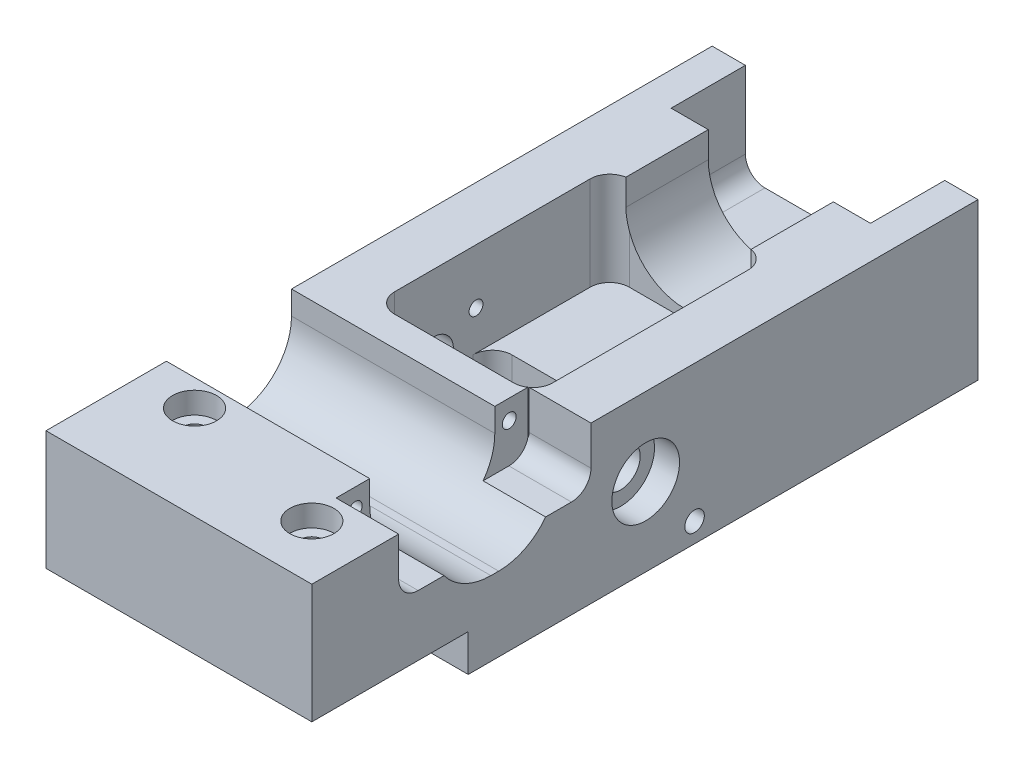
from build123d import *

# Parameters (mm, degrees)
BASE_DEPTH                    = 12.7
BASE_DEPTH_BACK               = 12.7
SKETCH1_W                     = 43.18
SKETCH1_H                     = 108.204
ACTUATORPLANECUT_DEPTH        = 6.0325
CENTERSLOT_DEPTH              = 60.619162222
CENTERSLOT_DEPTH_BACK         = 60.619162222
SKETCH5_W                     = 25.654
SKETCH5_H                     = 19.05
SHAFTGUIDE_REACH              = 113.065
SKETCH2_R                     = 4.7625
CENTERSLOTFILLET_R            = 3.175
GEARBOXPIT_DEPTH              = 11.176
FRONTCUTAWAY_DEPTH            = 15.24
GEARBOXSLOTSH_DEPTH           = 2.286
SKETCH55_R                    = 1.5875
GUIDEBARHOLE_DEPTH            = 71.376336961
PITCHSHAFTHOLE_DEPTH          = 60.619162279
PITCHSHAFTHOLE_DEPTH_BACK     = 60.619162279
SKETCH56_R                    = 3.175
SKETCH57_R                    = 5.5
BEARINGBORER_DEPTH            = 4.064
TOGGLEASSEMHOLES_D            = 2.7051
TOGGLEASSEMHOLES_DEPTH        = 9.398
TOGGLEASSEMHOLES_TIP          = 0.81269403
PITCHMOTORSLOT_DEPTH          = 71.37633704
PITCHMOTORMOUNTINGSLOTS_DEPTH = 10.16
PITCHMOTORMOUNTINGHOLES_D     = 2.2606
PITCHMOTORMOUNTINGHOLES_DEPTH = 7.5946
PITCHMOTORMOUNTINGHOLES_TIP   = 0.679152758
GEARBOXMOUNTINGHOLES_D        = 2.7051
GEARBOXMOUNTINGHOLES_DEPTH    = 9.398
GEARBOXMOUNTINGHOLES_TIP      = 0.81269403
CAPMOUNTINGHOLES_D            = 3.6576
CAPMOUNTINGHOLES_CBORE_D      = 7.14502
CAPMOUNTINGHOLES_CBORE_DEPTH  = 3.5052
ENCODERMOUNTINGHOLES_D        = 2.2606
ENCODERMOUNTINGHOLES_DEPTH    = 10.1346
ENCODERMOUNTINGHOLES_TIP      = 0.679152758
ROLLMOTORSLOT_REACH           = 113.065
ROLLMOTORMOUNTINGSLOTS_DEPTH  = 12.065
ROLLMOTORMOUNTINGHOLES_D      = 2.2606
ROLLMOTORMOUNTINGHOLES_DEPTH  = 7.62
ROLLMOTORMOUNTINGHOLES_TIP    = 0.679152758


with BuildPart() as part:
    # Sketch1 → Base (new, two sides: drawn at the far end of the back side and taken through both)
    with BuildSketch(Plane(origin=(0, 0, 0), x_dir=(1, 0, 0), z_dir=(0, 1, 0)).offset(-BASE_DEPTH_BACK)):
        Rectangle(SKETCH1_W, SKETCH1_H)
    extrude(amount=BASE_DEPTH + BASE_DEPTH_BACK)

    # Sketch3 → ActuatorPlaneCut (cut)
    with BuildSketch(Plane(origin=(0, -12.7, 0), x_dir=(-1, 0, 0), z_dir=(0, -1, 0))):
        Polygon((10.922, -28.702), (16.256, -28.702), (21.59, -28.702), (21.59, -54.102), (-21.59, -54.102), (-21.59, -28.702), (-10.922, -28.702), (-10.922, -11.176), (10.922, -11.176), align=None)
    extrude(amount=-ACTUATORPLANECUT_DEPTH, mode=Mode.SUBTRACT)

    # Sketch5 → CenterSlot (cut, two sides: drawn at the far end of the back side and taken through both)
    with BuildSketch(Plane(origin=(0, 0, 0), x_dir=(1, 0, 0), z_dir=(0, 1, 0)).offset(-CENTERSLOT_DEPTH_BACK)):
        with Locations((0, 0.127)):
            Rectangle(SKETCH5_W, SKETCH5_H)
    extrude(amount=CENTERSLOT_DEPTH + CENTERSLOT_DEPTH_BACK, mode=Mode.SUBTRACT)

    # Sketch2 → ShaftGuide (cut, up to next)
    with BuildSketch(Plane(origin=(0, 0, -54.102), x_dir=(-1, 0, 0), z_dir=(0, 0, -1)), mode=Mode.PRIVATE) as shaftguide_sk1:
        with Locations((0, -12.7)):
            Circle(SKETCH2_R)
    shaftguide_tool1 = extrude(shaftguide_sk1.sketch, amount=-SHAFTGUIDE_REACH, mode=Mode.PRIVATE) & part.part
    add(shaftguide_tool1.solids().sort_by_distance((0, -12.7, -54.102))[0], mode=Mode.SUBTRACT)

    # CenterSlotFillet
    centerslotfillet_edges = [part.edges().sort_by_distance(p)[0] for p in [
        (-12.827, 0, -9.652),
        (-12.827, 0, 9.398),
        (12.827, 0, 9.398),
        (12.827, 0, -9.652),
    ]]
    fillet(centerslotfillet_edges, radius=CENTERSLOTFILLET_R)

    # Sketch40 → GearBoxPit (cut)
    with BuildSketch(Plane.XZ.offset(12.7)):
        with BuildLine():
            Line((10.922, 6.858), (-10.922, 6.858))
            Line((-10.922, 6.858), (-10.922, 25.527))
            ThreePointArc((-10.922, 25.527), (-9.99206403, 27.77206403), (-7.747, 28.702))
            Line((-7.747, 28.702), (7.747, 28.702))
            ThreePointArc((7.747, 28.702), (9.99206403, 27.77206403), (10.922, 25.527))
            Line((10.922, 25.527), (10.922, 6.858))
        make_face()
    extrude(amount=-GEARBOXPIT_DEPTH, mode=Mode.SUBTRACT)

    # Sketch60 → FrontCutaway (cut)
    with BuildSketch(Plane(origin=(0, 12.7, 0), x_dir=(1, 0, 0), z_dir=(0, 1, 0))):
        with BuildLine():
            Line((-12.827, 6.477), (12.827, 6.477))
            Line((12.827, 6.477), (12.827, 25.527))
            ThreePointArc((12.827, 25.527), (11.89706403, 27.77206403), (9.652, 28.702))
            Line((9.652, 28.702), (-9.652, 28.702))
            ThreePointArc((-9.652, 28.702), (-11.89706403, 27.77206403), (-12.827, 25.527))
            Line((-12.827, 25.527), (-12.827, 6.477))
        make_face()
    extrude(amount=-FRONTCUTAWAY_DEPTH, mode=Mode.SUBTRACT)

    # Sketch67 → GearBoxSlotsH (cut)
    with BuildSketch(Plane(origin=(0, -12.7, 0), x_dir=(-1, 0, 0), z_dir=(0, -1, 0))):
        with BuildLine():
            Line((-12.3825, -12.811125), (12.3825, -12.811125))
            ThreePointArc((12.3825, -12.811125), (12.779375, -13.208), (12.3825, -13.604875))
            Line((12.3825, -13.604875), (-12.3825, -13.604875))
            ThreePointArc((-12.3825, -13.604875), (-12.779375, -13.208), (-12.3825, -12.811125))
        make_face()
        with BuildLine():
            Line((-12.3825, -23.479125), (12.3825, -23.479125))
            ThreePointArc((12.3825, -23.479125), (12.779375, -23.876), (12.3825, -24.272875))
            Line((12.3825, -24.272875), (-12.3825, -24.272875))
            ThreePointArc((-12.3825, -24.272875), (-12.779375, -23.876), (-12.3825, -23.479125))
        make_face()
    extrude(amount=-GEARBOXSLOTSH_DEPTH, mode=Mode.SUBTRACT)

    # Sketch55 → GuideBarHole (cut, through all)
    with BuildSketch(Plane.ZY.offset(21.59)):
        with Locations((-8.0645, -9.525)):
            Circle(SKETCH55_R)
    extrude(amount=-GUIDEBARHOLE_DEPTH, mode=Mode.SUBTRACT)

    # Sketch56 → PitchShaftHole (cut, two sides: drawn at the far end of the back side and taken through both)
    with BuildSketch(Plane(origin=(0, 0, 0), x_dir=(0, 0, -1), z_dir=(1, 0, 0)).offset(-PITCHSHAFTHOLE_DEPTH_BACK)):
        with Locations((0.127, 0)):
            Circle(SKETCH56_R)
    extrude(amount=PITCHSHAFTHOLE_DEPTH + PITCHSHAFTHOLE_DEPTH_BACK, mode=Mode.SUBTRACT)

    # Sketch57 → BearingBoreR (cut)
    with BuildSketch(Plane.ZY.offset(21.59)):
        with Locations((-0.127, 0)):
            Circle(SKETCH57_R)
    bearingborer = extrude(amount=-BEARINGBORER_DEPTH, mode=Mode.SUBTRACT)

    # BearingBoreL: BearingBoreR across plane
    add(bearingborer.mirror(Plane(origin=(0, 0, 0), x_dir=(0, 0, 1), z_dir=(1, 0, 0))), mode=Mode.SUBTRACT)

    # ToggleAssemHoles
    with Locations(Plane(origin=(0, -12.7, 0), x_dir=(-1, 0, 0), z_dir=(0, -1, 0))):
        with Locations((15.875, 22.352), (-15.875, 22.352)):
            Hole(TOGGLEASSEMHOLES_D / 2, depth=TOGGLEASSEMHOLES_DEPTH)
            with Locations((0, 0, -(TOGGLEASSEMHOLES_DEPTH + TOGGLEASSEMHOLES_TIP / 2))):  # 118° drill point
                Cone(0, TOGGLEASSEMHOLES_D / 2, TOGGLEASSEMHOLES_TIP, mode=Mode.SUBTRACT)

    # Sketch62 → PitchMotorSlot (cut, through all)
    with BuildSketch(Plane.ZY.offset(21.59)):
        with BuildLine():
            Line((14.224, 9.525), (14.224, 12.7))
            Line((14.224, 12.7), (34.544, 12.7))
            Line((34.544, 12.7), (34.544, 9.525))
            Line((34.544, 9.525), (34.544, 8.89))
            ThreePointArc((34.544, 8.89), (31.754192091, 2.154807909), (25.019, -0.635))
            Line((25.019, -0.635), (23.749, -0.635))
            ThreePointArc((23.749, -0.635), (17.013807909, 2.154807909), (14.224, 8.89))
            Line((14.224, 8.89), (14.224, 9.525))
        make_face()
    extrude(amount=-PITCHMOTORSLOT_DEPTH, mode=Mode.SUBTRACT)

    # Sketch63 → PitchMotorMountingSlots (cut)
    with BuildSketch(Plane.ZY.offset(-21.59)):
        with BuildLine():
            Line((8.763, 12.7), (40.005, 12.7))
            Line((40.005, 12.7), (40.005, 6.35))
            ThreePointArc((40.005, 6.35), (39.07506403, 4.10493597), (36.83, 3.175))
            Line((36.83, 3.175), (11.938, 3.175))
            ThreePointArc((11.938, 3.175), (9.69293597, 4.10493597), (8.763, 6.35))
            Line((8.763, 6.35), (8.763, 12.7))
        make_face()
    extrude(amount=PITCHMOTORMOUNTINGSLOTS_DEPTH, mode=Mode.SUBTRACT)

    # PitchMotorMountingHoles
    with Locations(Plane(origin=(11.43, 0, 0), x_dir=(0, 0, -1), z_dir=(1, 0, 0))):
        with Locations((-36.884, 9.525), (-11.884, 9.525)):
            Hole(PITCHMOTORMOUNTINGHOLES_D / 2, depth=PITCHMOTORMOUNTINGHOLES_DEPTH)
            with Locations((0, 0, -(PITCHMOTORMOUNTINGHOLES_DEPTH + PITCHMOTORMOUNTINGHOLES_TIP / 2))):  # 118° drill point
                Cone(0, PITCHMOTORMOUNTINGHOLES_D / 2, PITCHMOTORMOUNTINGHOLES_TIP, mode=Mode.SUBTRACT)

    # GearBoxMountingHoles
    with Locations(Plane(origin=(0, -12.7, 0), x_dir=(-1, 0, 0), z_dir=(0, -1, 0))):
        with Locations((-16.256, -18.542), (16.256, -18.542)):
            Hole(GEARBOXMOUNTINGHOLES_D / 2, depth=GEARBOXMOUNTINGHOLES_DEPTH)
            with Locations((0, 0, -(GEARBOXMOUNTINGHOLES_DEPTH + GEARBOXMOUNTINGHOLES_TIP / 2))):  # 118° drill point
                Cone(0, GEARBOXMOUNTINGHOLES_D / 2, GEARBOXMOUNTINGHOLES_TIP, mode=Mode.SUBTRACT)

    # CapMountingHoles (through all)
    with Locations(Plane(origin=(-0.837932951, 12.7, 8.633720573), x_dir=(-1, 0, 0), z_dir=(0, 1, 0))):
        with Locations((-13.537932951, 36.578279427), (11.862067049, 30.228279427)):
            CounterBoreHole(CAPMOUNTINGHOLES_D / 2, CAPMOUNTINGHOLES_CBORE_D / 2, CAPMOUNTINGHOLES_CBORE_DEPTH)

    # EncoderMountingHoles
    with Locations(Plane.ZY.offset(21.59)):
        with Locations((6.731, 3.81), (-6.985, 3.81)):
            Hole(ENCODERMOUNTINGHOLES_D / 2, depth=ENCODERMOUNTINGHOLES_DEPTH)
            with Locations((0, 0, -(ENCODERMOUNTINGHOLES_DEPTH + ENCODERMOUNTINGHOLES_TIP / 2))):  # 118° drill point
                Cone(0, ENCODERMOUNTINGHOLES_D / 2, ENCODERMOUNTINGHOLES_TIP, mode=Mode.SUBTRACT)

    # Sketch81 → RollMotorSlot (cut, up to next)
    with BuildSketch(Plane(origin=(0, 0, -54.102), x_dir=(-1, 0, 0), z_dir=(0, 0, -1)), mode=Mode.PRIVATE) as rollmotorslot_sk1:
        with BuildLine():
            Line((10.16, 12.7), (-10.16, 12.7))
            Line((-10.16, 12.7), (-10.16, 8.46582))
            ThreePointArc((-10.16, 8.46582), (-7.370192091, 1.730627909), (-0.635, -1.05918))
            Line((-0.635, -1.05918), (0.635, -1.05918))
            ThreePointArc((0.635, -1.05918), (7.370192091, 1.730627909), (10.16, 8.46582))
            Line((10.16, 8.46582), (10.16, 12.7))
        make_face()
    rollmotorslot_tool1 = extrude(rollmotorslot_sk1.sketch, amount=-ROLLMOTORSLOT_REACH, mode=Mode.PRIVATE) & part.part
    add(rollmotorslot_tool1.solids().sort_by_distance((0, 6.589347, -54.102))[0], mode=Mode.SUBTRACT)

    # Sketch84 → RollMotorMountingSlots (cut)
    with BuildSketch(Plane(origin=(0, 0, -54.102), x_dir=(-1, 0, 0), z_dir=(0, 0, -1))):
        with BuildLine():
            Line((16.1925, 12.7), (-16.1925, 12.7))
            Line((-16.1925, 12.7), (-16.1925, 0.21082))
            ThreePointArc((-16.1925, 0.21082), (-15.26256403, -2.03424403), (-13.0175, -2.96418))
            Line((-13.0175, -2.96418), (13.0175, -2.96418))
            ThreePointArc((13.0175, -2.96418), (15.26256403, -2.03424403), (16.1925, 0.21082))
            Line((16.1925, 0.21082), (16.1925, 12.7))
        make_face()
    extrude(amount=-ROLLMOTORMOUNTINGSLOTS_DEPTH, mode=Mode.SUBTRACT)

    # RollMotorMountingHoles
    with Locations(Plane(origin=(0, 0, -42.037), x_dir=(-1, 0, 0), z_dir=(0, 0, -1))):
        with Locations((12.5, 8.46582), (-12.5, 8.46582)):
            Hole(ROLLMOTORMOUNTINGHOLES_D / 2, depth=ROLLMOTORMOUNTINGHOLES_DEPTH)
            with Locations((0, 0, -(ROLLMOTORMOUNTINGHOLES_DEPTH + ROLLMOTORMOUNTINGHOLES_TIP / 2))):  # 118° drill point
                Cone(0, ROLLMOTORMOUNTINGHOLES_D / 2, ROLLMOTORMOUNTINGHOLES_TIP, mode=Mode.SUBTRACT)


solid = part.part
